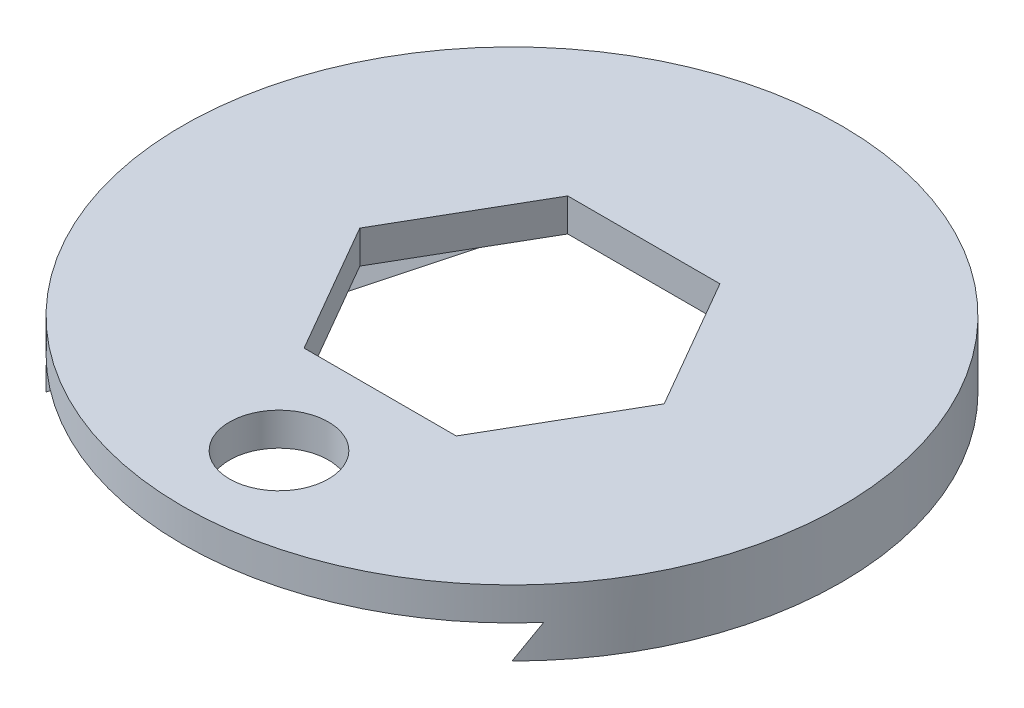
from build123d import *

# Parameters (mm, degrees)
SKETCH1_R               = 50
BOSS_EXTRUDE1_DEPTH     = 5
BOSS_EXTRUDE2_START     = -5
BOSS_EXTRUDE2_DEPTH     = 5
DRAFT1_ANGLE            = -30
CUT_EXTRUDE2_DEPTH      = 71.887234394
CUT_EXTRUDE2_DEPTH_BACK = 71.887234394
SKETCH1_8_R             = 7.5
CUT_EXTRUDE3_DEPTH      = 71.887234394


with BuildPart() as part:
    # Sketch1 → Boss-Extrude1 (new body)
    with BuildSketch(Plane(origin=(0, 0, 0), x_dir=(1, 0, 0), z_dir=(0, 1, 0))):
        Circle(SKETCH1_R)
    extrude(amount=BOSS_EXTRUDE1_DEPTH)

    # Sketch1<5> → Boss-Extrude2 (add)
    with BuildSketch(Plane(origin=(0, 0, 0), x_dir=(1, 0, 0), z_dir=(0, 1, 0)).offset(BOSS_EXTRUDE2_START)):
        with BuildLine():
            ThreePointArc((-12.940952255, 48.296291314), (-48.296291314, 12.940952255), (-35.355339059, -35.355339059))
            Line((-35.355339059, -35.355339059), (-12.940952255, 48.296291314))
        make_face()
        with BuildLine():
            Line((12.940952255, 48.296291314), (35.355339059, -35.355339059))
            ThreePointArc((35.355339059, -35.355339059), (48.296291314, 12.940952255), (12.940952255, 48.296291314))
        make_face()
    extrude(amount=BOSS_EXTRUDE2_DEPTH)

    # Draft1
    draft1_faces = [part.faces().sort_by_distance(p)[0] for p in [
        (24.148145657, -2.5, -6.470476128),
        (-24.148145657, -2.5, -6.470476128),
    ]]
    draft(draft1_faces, Plane(origin=(0, -5, 0), x_dir=(0, 0, -1), z_dir=(0, -1, 0)), DRAFT1_ANGLE)

    # Sketch1<8> → Cut-Extrude2 (cut, two sides: drawn at the far end of the back side and taken through both)
    with BuildSketch(Plane(origin=(0, 0, 0), x_dir=(1, 0, 0), z_dir=(0, 1, 0)).offset(-CUT_EXTRUDE2_DEPTH_BACK)):
        with Locations((0, -35.355339059)):
            Circle(SKETCH1_8_R)
    extrude(amount=CUT_EXTRUDE2_DEPTH + CUT_EXTRUDE2_DEPTH_BACK, mode=Mode.SUBTRACT)

    # Sketch2 → Cut-Extrude3 (cut, through all)
    with BuildSketch(Plane.XZ):
        Polygon((23.094010768, 0), (11.547005384, 20), (-11.547005384, 20), (-23.094010768, 0), (-11.547005384, -20), (11.547005384, -20), align=None)
    extrude(amount=-CUT_EXTRUDE3_DEPTH, mode=Mode.SUBTRACT)


solid = part.part
